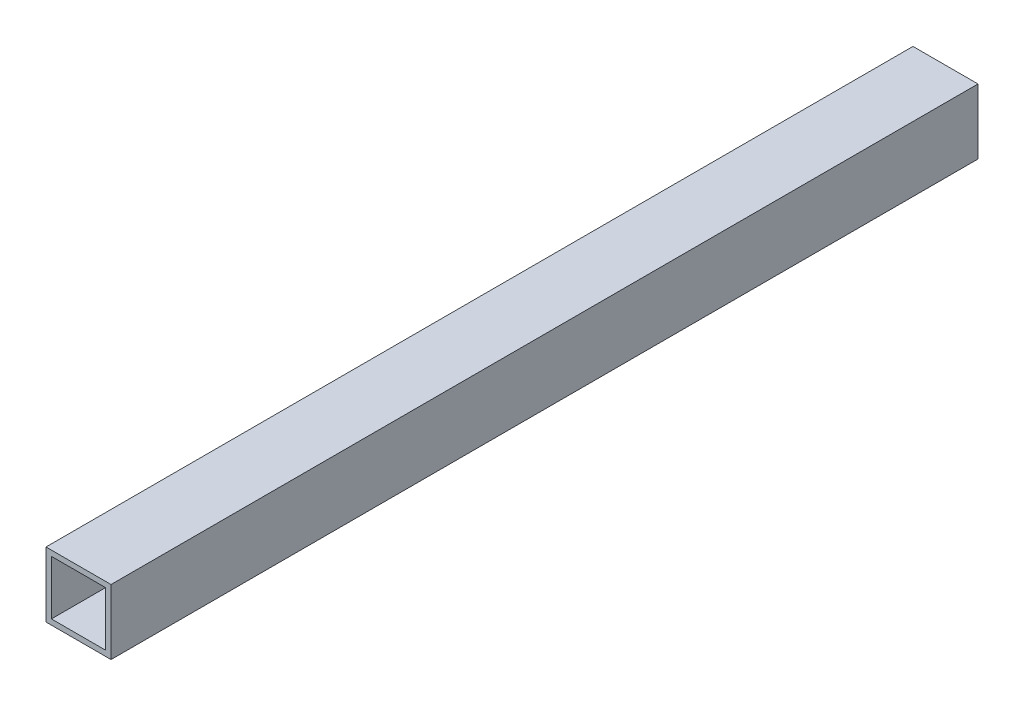
from build123d import *

# Parameters (mm, degrees)
SKETCH1_W           = 30
SKETCH1_H           = 30
SKETCH1_W_2         = 25
SKETCH1_H_2         = 25
BOSS_EXTRUDE1_DEPTH = 200


with BuildPart() as part:
    # Sketch1 → Boss-Extrude1 (new, symmetric)
    with BuildSketch(Plane.XY):
        Rectangle(SKETCH1_W, SKETCH1_H)
        Rectangle(SKETCH1_W_2, SKETCH1_H_2, mode=Mode.SUBTRACT)
    extrude(amount=BOSS_EXTRUDE1_DEPTH, both=True)


solid = part.part
